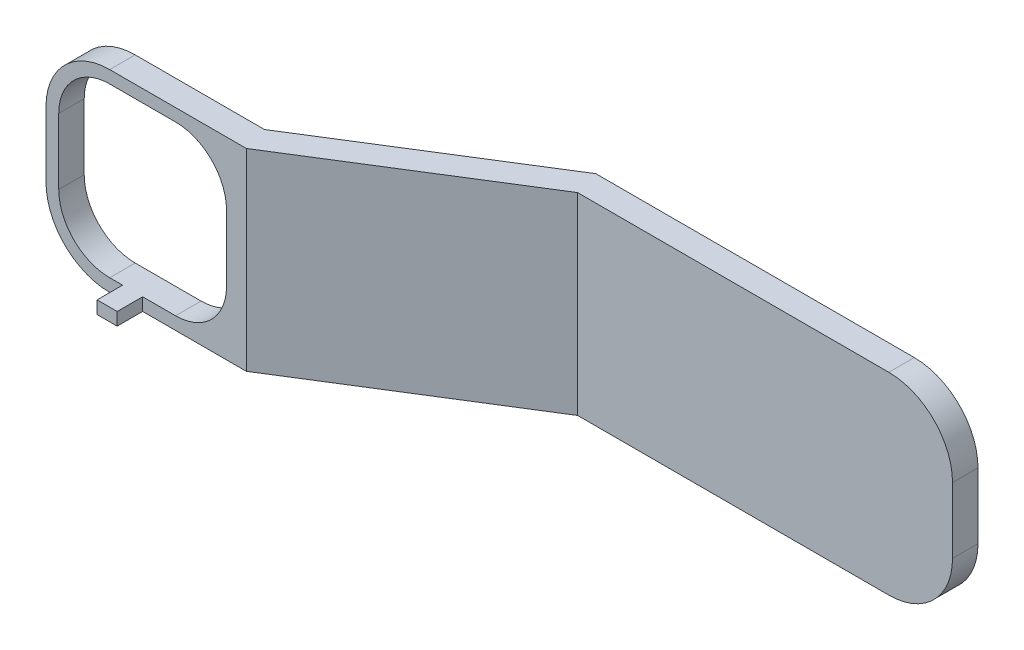
from build123d import *

# Parameters (mm, degrees)
EXTRUDE_THIN1_DEPTH = 9.62000108
CUT_EXTRUDE1_DEPTH  = 80.723760299
FILLET1_R           = 6.35
SKETCH4_W           = 2.00000108
SKETCH4_H           = 1.27
BOSS_EXTRUDE1_DEPTH = 2.54


with BuildPart() as part:
    # Sketch2 → Extrude-Thin1 (new, symmetric)
    with BuildSketch(Plane(origin=(0, 0, 0), x_dir=(1, 0, 0), z_dir=(0, 1, 0))):
        Polygon((0, 0), (19.24000216, 0), (39.56000216, 12.7), (77.66000216, 12.7), (77.66000216, 10.16), (40.288464575, 10.16), (19.968464575, -2.54), (0, -2.54), align=None)
    extrude(amount=EXTRUDE_THIN1_DEPTH, both=True)

    # Sketch3 → Cut-Extrude1 (cut, through all)
    with BuildSketch(Plane.XY.offset(2.54)):
        with BuildLine():
            Line((6.35, 8.37540108), (12.91540216, 8.37540108))
            ThreePointArc((12.91540216, 8.37540108), (16.507504608, 6.887503528), (17.99540216, 3.29540108))
            Line((17.99540216, 3.29540108), (17.99540216, -3.27000108))
            ThreePointArc((17.99540216, -3.27000108), (16.507504608, -6.862103528), (12.91540216, -8.35000108))
            Line((12.91540216, -8.35000108), (6.35, -8.35000108))
            ThreePointArc((6.35, -8.35000108), (2.757897552, -6.862103528), (1.27, -3.27000108))
            Line((1.27, -3.27000108), (1.27, 3.29540108))
            ThreePointArc((1.27, 3.29540108), (2.757897552, 6.887503528), (6.35, 8.37540108))
        make_face()
    extrude(amount=-CUT_EXTRUDE1_DEPTH, mode=Mode.SUBTRACT)

    # Fillet1
    fillet1_edges = [part.edges().sort_by_distance(p)[0] for p in [
        (77.66000216, -9.62000108, -11.43),
        (77.66000216, 9.62000108, -11.43),
        (0, -9.62000108, 1.27),
        (0, 9.62000108, 1.27),
    ]]
    fillet(fillet1_edges, radius=FILLET1_R)

    # Sketch4 → Boss-Extrude1 (add)
    with BuildSketch(Plane.XY.offset(2.54)):
        with Locations((8.63270054, -8.98500108)):
            Rectangle(SKETCH4_W, SKETCH4_H)
    extrude(amount=BOSS_EXTRUDE1_DEPTH)


solid = part.part
